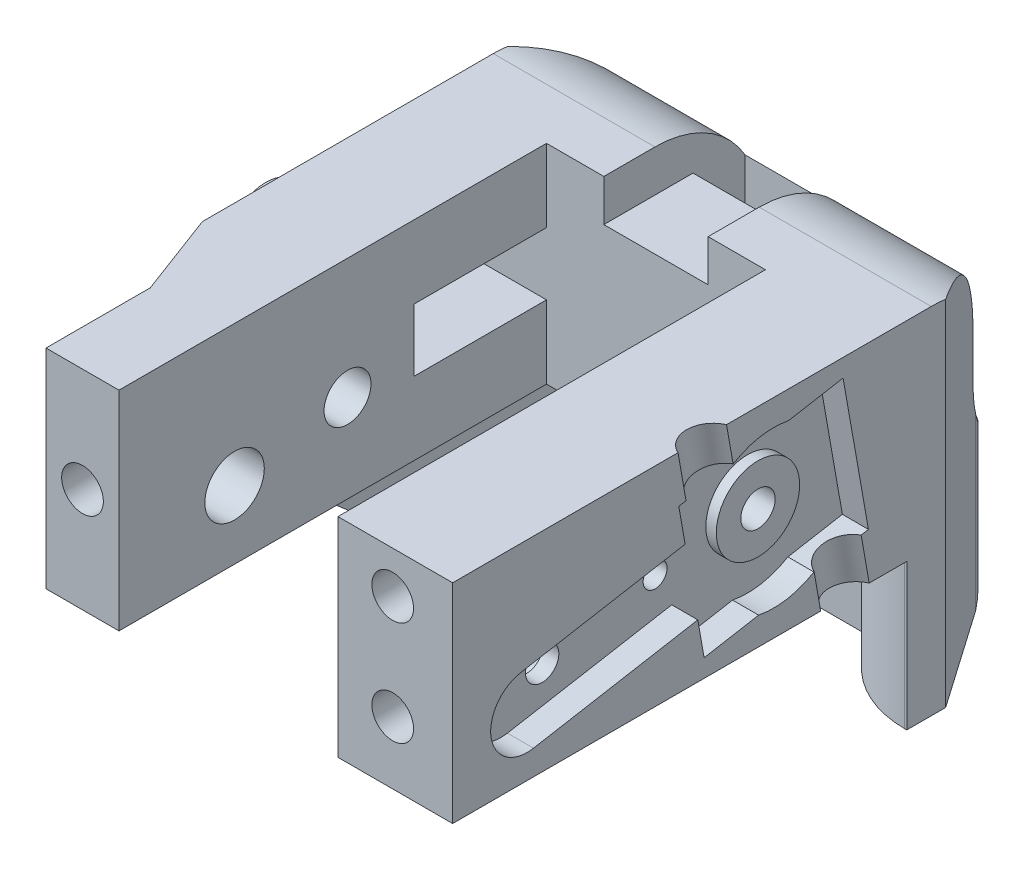
from build123d import *

# Parameters (mm, degrees)
BOSS_EXTRUDE1_DEPTH             = 20
SKETCH6_W                       = 25
SKETCH6_H                       = 20
BOSS_EXTRUDE5_DEPTH             = 5.5
BOSS_EXTRUDE11_START            = -20
BOSS_EXTRUDE11_DEPTH            = 34
SKETCH4_R                       = 2
CUT_EXTRUDE1_DEPTH              = 10
BOSS_EXTRUDE13_DEPTH            = 12
FILLET11_START                  = 14.0499999
FILLET11_DEPTH                  = 7.9500001
FILLET11_START_2                = -14.996842371
FILLET11_2_DEPTH                = 30.996842371
CHAMFER1_SIZE                   = 14
SKETCH26_W                      = 22
SKETCH26_H                      = 20
BOSS_EXTRUDE14_DEPTH            = 11
CUT_EXTRUDE7_DEPTH              = 2.5
CUT_EXTRUDE8_REACH              = 65.92
SKETCH27_R                      = 4
SKETCH27_R_2                    = 1.15
SKETCH27_R_3                    = 1.6
CUT_EXTRUDE9_DEPTH              = 2.5
CUT_EXTRUDE10_REACH             = 50.596
SKETCH29_R                      = 2.5
CUT_EXTRUDE11_REACH             = 55.607
SKETCH30_R                      = 2.5
BOSS_EXTRUDE15_DEPTH            = 1
BOSS_EXTRUDE15_DEPTH_BACK       = 2
SKETCH31_R                      = 4
SKETCH31_R_2                    = 1.65
SKETCH32_R                      = 2.85
SKETCH32_R_2                    = 2.25
CUT_EXTRUDE12_DEPTH             = 7
CUT_EXTRUDE12_DIRECTION_2_REACH = 61.046
SKETCH33_R                      = 3.8
BOSS_EXTRUDE17_DEPTH            = 7
FILLET17_R                      = 1
CUT_EXTRUDE13_DEPTH             = 14
SKETCH36_R                      = 2
CUT_EXTRUDE14_DEPTH             = 10
FILLET18_R                      = 10
CUT_EXTRUDE16_REACH             = 67.49
SKETCH37_W                      = 5.717933373
SKETCH37_H                      = 6
CHAMFER2_SIZE                   = 7
SKETCH38_W                      = 10
SKETCH38_H                      = 20
CUT_EXTRUDE17_DEPTH             = 4
CUT_EXTRUDE19_REACH             = 59.527
SKETCH39_W                      = 10
SKETCH39_H                      = 5
CUT_EXTRUDE20_DEPTH             = 112.274986141
CUT_EXTRUDE20_DEPTH_BACK        = 112.274986141
SKETCH40_W                      = 63.577932813
SKETCH40_H                      = 85.383198243
SKETCH41_R                      = 2
CUT_EXTRUDE21_DEPTH             = 8
CUT_EXTRUDE22_DEPTH             = 119.920656492
CUT_EXTRUDE22_DEPTH_BACK        = 119.920656492
SKETCH42_W                      = 84.196844861
SKETCH42_H                      = 67.727613246


with BuildPart() as part:
    # Sketch1 → Boss-Extrude1 (new body)
    with BuildSketch(Plane(origin=(0, 0, 0), x_dir=(1, 0, 0), z_dir=(0, 1, 0))):
        Polygon((-15.5, -37), (-10, -37), (-10, 4), (11, 4), (11, -37), (18, -37), (18, -27), (21, -19), (21, 10), (-15.5, 10), align=None)
    extrude(amount=BOSS_EXTRUDE1_DEPTH)

    # Sketch6 → Boss-Extrude5 (add)
    with BuildSketch(Plane.ZY.offset(15.5)):
        with Locations((2.5, 10)):
            Rectangle(SKETCH6_W, SKETCH6_H)
    extrude(amount=BOSS_EXTRUDE5_DEPTH)

    # Sketch20 → Boss-Extrude11 (add)
    with BuildSketch(Plane(origin=(0, 20, 0), x_dir=(1, 0, 0), z_dir=(0, 1, 0)).offset(BOSS_EXTRUDE11_START)):
        Polygon((-21, 6.554166437), (13, 6.554166437), (13, -16.445833563), (21.006315459, -11.823385178), (21.006315459, 10.282066627), (15.003157729, 18.901571597), (-14.996842271, 18.901571597), (-21, 10.282066627), align=None)
    extrude(amount=BOSS_EXTRUDE11_DEPTH)

    # Sketch4 → Cut-Extrude1 (cut)
    with BuildSketch(Plane(origin=(0, 20, 0), x_dir=(1, 0, 0), z_dir=(0, 1, 0))):
        with Locations(Location((-4.375, 8, 0), (0, 0, 270))):
            Circle(SKETCH4_R)
        with Locations(Location((5.375, 8, 0), (0, 0, 270))):
            Circle(SKETCH4_R)
    extrude(amount=-CUT_EXTRUDE1_DEPTH, mode=Mode.SUBTRACT)

    # Sketch24 → Boss-Extrude13 (add)
    with BuildSketch(Plane(origin=(0, 34, 0), x_dir=(1, 0, 0), z_dir=(0, 1, 0))):
        with BuildLine():
            Line((-14.996842271, 18.901571597), (-14.420936492, 19.728473528))
            ThreePointArc((-14.420936492, 19.728473528), (-3.81756267, 26.467738085), (8.613124034, 24.643662635))
            ThreePointArc((8.613124034, 24.643662635), (12.140366622, 22.142331504), (15.003157729, 18.901571597))
            Line((15.003157729, 18.901571597), (21.006315459, 10.282066627))
            Line((21.006315459, 10.282066627), (21.006315459, 6.554166437))
            Line((21.006315459, 6.554166437), (-21, 6.554166437))
            Line((-21, 6.554166437), (-21, 10.282066627))
            Line((-21, 10.282066627), (-14.996842271, 18.901571597))
        make_face()
    extrude(amount=-BOSS_EXTRUDE13_DEPTH)

    # Fillet11: read off the stored shape, not the designer's step
    # Fillet11 outline → Fillet11 (add)
    with BuildSketch(Plane(origin=(0, 0, 0), x_dir=(1, 0, 0), z_dir=(0, 1, 0)).offset(FILLET11_START)):
        with BuildLine():
            Line((-14.996842271, 18.901571597), (15.003161757, 18.901565813))
            ThreePointArc((15.003161757, 18.901565813), (12.140369243, 22.142329149), (8.613124034, 24.643662635))
            ThreePointArc((8.613124034, 24.643662635), (-3.81756267, 26.467738085), (-14.420936492, 19.728473528))
            Line((-14.420936492, 19.728473528), (-14.996842271, 18.901571597))
        make_face()
    extrude(amount=FILLET11_DEPTH)

    # Fillet11 2 outline → Fillet11 2 (cut)
    with BuildSketch(Plane.YZ.offset(FILLET11_START_2)):
        with BuildLine():
            Line((22, -28), (22, -26.851571597))
            ThreePointArc((22, -26.851571597), (19.67149891, -21.230072687), (14.05, -18.901571597))
            Line((14.05, -18.901571597), (14.0499999, -28))
            Line((14.0499999, -28), (22, -28))
        make_face()
    extrude(amount=FILLET11_2_DEPTH, mode=Mode.SUBTRACT)

    # Chamfer1
    chamfer1_edges = [part.edges().sort_by_distance(p)[0] for p in [
        (17.003157729, 34, 14.134609371),
    ]]
    chamfer(chamfer1_edges, length=CHAMFER1_SIZE)

    # Sketch26 → Boss-Extrude14 (add)
    with BuildSketch(Plane.ZY.offset(21)):
        with Locations((26, 10)):
            Rectangle(SKETCH26_W, SKETCH26_H)
    extrude(amount=-BOSS_EXTRUDE14_DEPTH)

    # Sketch25 → Cut-Extrude7 (cut)
    with BuildSketch(Plane.ZY.offset(21)):
        with BuildLine():
            Line((12.142640366, 14.598678837), (29.245550824, 17.6143834))
            ThreePointArc((29.245550824, 17.6143834), (33.300146581, 14.775324886), (30.461088067, 10.720729128))
            Line((30.461088067, 10.720729128), (13.35817761, 7.705024566))
            ThreePointArc((13.35817761, 7.705024566), (-1.168124774, 8.697638667), (12.142640366, 14.598678837))
        make_face()
    extrude(amount=-CUT_EXTRUDE7_DEPTH, mode=Mode.SUBTRACT)

    # Sketch27 → Cut-Extrude8 (cut, up to next)
    with BuildSketch(Plane.ZY.offset(18.5), mode=Mode.PRIVATE) as cut_extrude8_sk1:
        with Locations((6.217933373, 10)):
            Circle(SKETCH27_R)
    cut_extrude8_tool1 = extrude(cut_extrude8_sk1.sketch, amount=-CUT_EXTRUDE8_REACH, mode=Mode.PRIVATE) & part.part
    # Sketch27 → Cut-Extrude8 (cut, up to next)
    with BuildSketch(Plane.ZY.offset(18.5), mode=Mode.PRIVATE) as cut_extrude8_sk2:
        with Locations((15.08120315, 11.562833599)):
            Circle(SKETCH27_R_2)
    cut_extrude8_tool2 = extrude(cut_extrude8_sk2.sketch, amount=-CUT_EXTRUDE8_REACH, mode=Mode.PRIVATE) & part.part
    # Sketch27 → Cut-Extrude8 (cut, up to next)
    with BuildSketch(Plane.ZY.offset(18.5), mode=Mode.PRIVATE) as cut_extrude8_sk3:
        with Locations((25.914088433, 13.472963553)):
            Circle(SKETCH27_R_3)
    cut_extrude8_tool3 = extrude(cut_extrude8_sk3.sketch, amount=-CUT_EXTRUDE8_REACH, mode=Mode.PRIVATE) & part.part
    add(cut_extrude8_tool1.solids().sort_by_distance((-18.5, 10, 6.217933))[0], mode=Mode.SUBTRACT)
    add(cut_extrude8_tool2.solids().sort_by_distance((-18.5, 11.562834, 15.081203))[0], mode=Mode.SUBTRACT)
    add(cut_extrude8_tool3.solids().sort_by_distance((-18.5, 13.472964, 25.914088))[0], mode=Mode.SUBTRACT)

    # Sketch28 → Cut-Extrude9 (cut)
    with BuildSketch(Plane.ZY.offset(21)):
        Polygon((-2.876065895, 15.50446885), (12.880858154, 18.282839692), (15.311932641, 4.49553115), (-0.444991407, 1.717160308), align=None)
    extrude(amount=-CUT_EXTRUDE9_DEPTH, mode=Mode.SUBTRACT)

    # Cut-Extrude10: up to this plane
    cut_extrude10_end = Plane(origin=(0, 20, 0), z_dir=(0, -1, 0))
    # Sketch29 → Cut-Extrude10 (cut, up to the surface)
    with BuildSketch(Plane(origin=(0, 15.528788143, -2.738144327), x_dir=(1, 0, 0), z_dir=(0, -0.9848077530122088, 0.17364817766692708)), mode=Mode.PRIVATE) as cut_extrude10_sk1:
        with Locations((-22, 2.85995077)):
            Circle(SKETCH29_R)
    cut_extrude10_tool1 = split(extrude(cut_extrude10_sk1.sketch, amount=-CUT_EXTRUDE10_REACH, mode=Mode.PRIVATE), bisect_by=cut_extrude10_end, keep=Keep.BOTH, mode=Mode.PRIVATE)
    add(cut_extrude10_tool1.solids().sort_by_distance((-22, 16.025413, 0.078357))[0], mode=Mode.SUBTRACT)

    # Cut-Extrude11: up to this plane
    cut_extrude11_end = Plane(origin=(0, 0, 0), z_dir=(0, -1, 0))
    # Sketch30 → Cut-Extrude11 (cut, up to the surface)
    with BuildSketch(Plane(origin=(0, 1.741479601, -0.30706984), x_dir=(1, 0, 0), z_dir=(0, 0.9848077530122086, -0.17364817766692728)), mode=Mode.PRIVATE) as cut_extrude11_sk1:
        with Locations((-22, -12.85995077)):
            Circle(SKETCH30_R)
    cut_extrude11_tool1 = split(extrude(cut_extrude11_sk1.sketch, amount=-CUT_EXTRUDE11_REACH, mode=Mode.PRIVATE), bisect_by=cut_extrude11_end, keep=Keep.BOTH, mode=Mode.PRIVATE)
    add(cut_extrude11_tool1.solids().sort_by_distance((-22, 3.974587, 12.357509))[0], mode=Mode.SUBTRACT)

    # Sketch31 → Boss-Extrude15 (add, two sides: drawn at the far end of the back side and taken through both)
    with BuildSketch(Plane.ZY.offset(18.5).offset(-BOSS_EXTRUDE15_DEPTH_BACK)):
        with Locations((6.217933373, 10)):
            Circle(SKETCH31_R)
        with Locations((6.217933373, 10)):
            Circle(SKETCH31_R_2, mode=Mode.SUBTRACT)
    extrude(amount=BOSS_EXTRUDE15_DEPTH + BOSS_EXTRUDE15_DEPTH_BACK)

    # Sketch32 → Cut-Extrude12 (cut)
    with BuildSketch(Plane(origin=(-10, 0, 0), x_dir=(0, 0, -1), z_dir=(1, 0, 0))):
        with Locations((-25.914088433, 13.472963553)):
            Circle(SKETCH32_R)
        with Locations((-15.08120315, 11.562833599)):
            Circle(SKETCH32_R_2)
    extrude(amount=-CUT_EXTRUDE12_DEPTH, mode=Mode.SUBTRACT)

    # Sketch32 → Cut-Extrude12 direction 2 (cut, up to next)
    with BuildSketch(Plane(origin=(-10, 0, 0), x_dir=(0, 0, -1), z_dir=(1, 0, 0)), mode=Mode.PRIVATE) as cut_extrude12_direction_2_sk1:
        with Locations((-25.914088433, 13.472963553)):
            Circle(SKETCH32_R)
    cut_extrude12_direction_2_tool1 = extrude(cut_extrude12_direction_2_sk1.sketch, amount=CUT_EXTRUDE12_DIRECTION_2_REACH, mode=Mode.PRIVATE) & part.part
    # Sketch32 → Cut-Extrude12 direction 2 (cut, up to next)
    with BuildSketch(Plane(origin=(-10, 0, 0), x_dir=(0, 0, -1), z_dir=(1, 0, 0)), mode=Mode.PRIVATE) as cut_extrude12_direction_2_sk2:
        with Locations((-15.08120315, 11.562833599)):
            Circle(SKETCH32_R_2)
    cut_extrude12_direction_2_tool2 = extrude(cut_extrude12_direction_2_sk2.sketch, amount=CUT_EXTRUDE12_DIRECTION_2_REACH, mode=Mode.PRIVATE) & part.part
    add(cut_extrude12_direction_2_tool1.solids().sort_by_distance((-10, 13.472964, 25.914088))[0], mode=Mode.SUBTRACT)
    add(cut_extrude12_direction_2_tool2.solids().sort_by_distance((-10, 11.562834, 15.081203))[0], mode=Mode.SUBTRACT)

    # Sketch33 → Boss-Extrude17 (add)
    with BuildSketch(Plane(origin=(21.006315459, 0, 0), x_dir=(0, 0, -1), z_dir=(1, 0, 0))):
        with Locations((-6.217933373, 10)):
            Circle(SKETCH33_R)
    extrude(amount=BOSS_EXTRUDE17_DEPTH)

    # Fillet17
    fillet17_edges = [part.edges().sort_by_distance(p)[0] for p in [
        (28.006315459, 10, 10.017933373),
    ]]
    fillet(fillet17_edges, radius=FILLET17_R)

    # Sketch35 → Cut-Extrude13 (cut)
    with BuildSketch(Plane(origin=(0, 34, 0), x_dir=(1, 0, 0), z_dir=(0, 1, 0))):
        with BuildLine():
            Line((-20.79995418, 6.554166437), (13, 6.554166437))
            Line((13, 6.554166437), (13, 12.554166437))
            Line((13, 12.554166437), (-10.802737675, 12.554166437))
            ThreePointArc((-10.802737675, 12.554166437), (-12.071315957, 11.281715365), (-13.284990593, 9.95679406))
            ThreePointArc((-13.284990593, 9.95679406), (-16.675255632, 7.444453934), (-20.79995418, 6.554166437))
        make_face()
    extrude(amount=-CUT_EXTRUDE13_DEPTH, mode=Mode.SUBTRACT)

    # Sketch36 → Cut-Extrude14 (cut)
    with BuildSketch(Plane.XY.offset(37)):
        with Locations((-15.25, 14)):
            Circle(SKETCH36_R)
        with Locations((14.5, 10)):
            Circle(SKETCH36_R)
        with Locations((-15.25, 4)):
            Circle(SKETCH36_R)
    extrude(amount=-CUT_EXTRUDE14_DEPTH, mode=Mode.SUBTRACT)

    # Fillet18
    fillet18_edges = [part.edges().sort_by_distance(p)[0] for p in [
        (0.003157729, 0, -18.901571597),
    ]]
    fillet(fillet18_edges, radius=FILLET18_R)

    # Sketch37 → Cut-Extrude16 (cut, up to next)
    with BuildSketch(Plane(origin=(21, 0, 0), x_dir=(0, 0, -1), z_dir=(1, 0, 0)), mode=Mode.PRIVATE) as cut_extrude16_sk1:
        with Locations((1.141033313, 10)):
            Rectangle(SKETCH37_W, SKETCH37_H)
    cut_extrude16_tool1 = extrude(cut_extrude16_sk1.sketch, amount=-CUT_EXTRUDE16_REACH, mode=Mode.PRIVATE) & part.part
    add(cut_extrude16_tool1.solids().sort_by_distance((21, 10, -1.141033))[0], mode=Mode.SUBTRACT)

    # Chamfer2
    chamfer2_edges = [part.edges().sort_by_distance(p)[0] for p in [
        (11, 10, 1.717933373),
    ]]
    chamfer(chamfer2_edges, length=CHAMFER2_SIZE)

    # Sketch38 → Cut-Extrude17 (cut)
    with BuildSketch(Plane.XZ):
        with Locations((0.5, -14)):
            Rectangle(SKETCH38_W, SKETCH38_H)
    extrude(amount=-CUT_EXTRUDE17_DEPTH, mode=Mode.SUBTRACT)

    # Sketch39 → Cut-Extrude19 (cut, up to next)
    with BuildSketch(Plane(origin=(0, 34, 0), x_dir=(1, 0, 0), z_dir=(0, 1, 0)), mode=Mode.PRIVATE) as cut_extrude19_sk1:
        with Locations((0.5, 15.054166437)):
            Rectangle(SKETCH39_W, SKETCH39_H)
    cut_extrude19_tool1 = extrude(cut_extrude19_sk1.sketch, amount=-CUT_EXTRUDE19_REACH, mode=Mode.PRIVATE) & part.part
    add(cut_extrude19_tool1.solids().sort_by_distance((0.5, 34, -15.054166))[0], mode=Mode.SUBTRACT)


with BuildPart() as body_2:
    # Mirror1: mirrored copy
    add(part.part.mirror(Plane.ZY.offset(31)))

    # Sketch41 → Cut-Extrude21 (cut)
    with BuildSketch(Plane(origin=(0, 34, 0), x_dir=(1, 0, 0), z_dir=(0, 1, 0))):
        with Locations(Location((-67.110696208, 22.514658427, 0), (0, 0, 270))):
            Circle(SKETCH41_R)
        with Locations(Location((-77.910696208, 11.606522541, 0), (0, 0, 270))):
            Circle(SKETCH41_R)
    extrude(amount=-CUT_EXTRUDE21_DEPTH, mode=Mode.SUBTRACT)


with BuildPart() as part_1:
    add(part.part)

    # Sketch40 → Cut-Extrude20 (cut, two sides: drawn at the far end of the back side and taken through both)
    with BuildSketch(Plane(origin=(0, 0, -18.901571597), x_dir=(-1, 0, 0), z_dir=(0, 0, -1)).offset(-CUT_EXTRUDE20_DEPTH_BACK)):
        with Locations((-5.368663992, 38.471473394)):
            Rectangle(SKETCH40_W, SKETCH40_H)
    extrude(amount=CUT_EXTRUDE20_DEPTH + CUT_EXTRUDE20_DEPTH_BACK, mode=Mode.SUBTRACT)


with BuildPart() as body_2_2:
    # Mirror2: mirrored copy
    add(body_2.part.mirror(Plane(origin=(0, -10, 0), x_dir=(0, 0, 1), z_dir=(0, -1, 0))))


with BuildPart() as body_2_1:
    add(body_2.part)

    # Sketch42 → Cut-Extrude22 (cut, two sides: drawn at the far end of the back side and taken through both)
    with BuildSketch(Plane(origin=(0, 0, -18.901571597), x_dir=(-1, 0, 0), z_dir=(0, 0, -1)).offset(-CUT_EXTRUDE22_DEPTH_BACK)):
        with Locations((54.256170368, 21.919920772)):
            Rectangle(SKETCH42_W, SKETCH42_H)
    extrude(amount=CUT_EXTRUDE22_DEPTH + CUT_EXTRUDE22_DEPTH_BACK, mode=Mode.SUBTRACT)


solid = body_2_2.part
